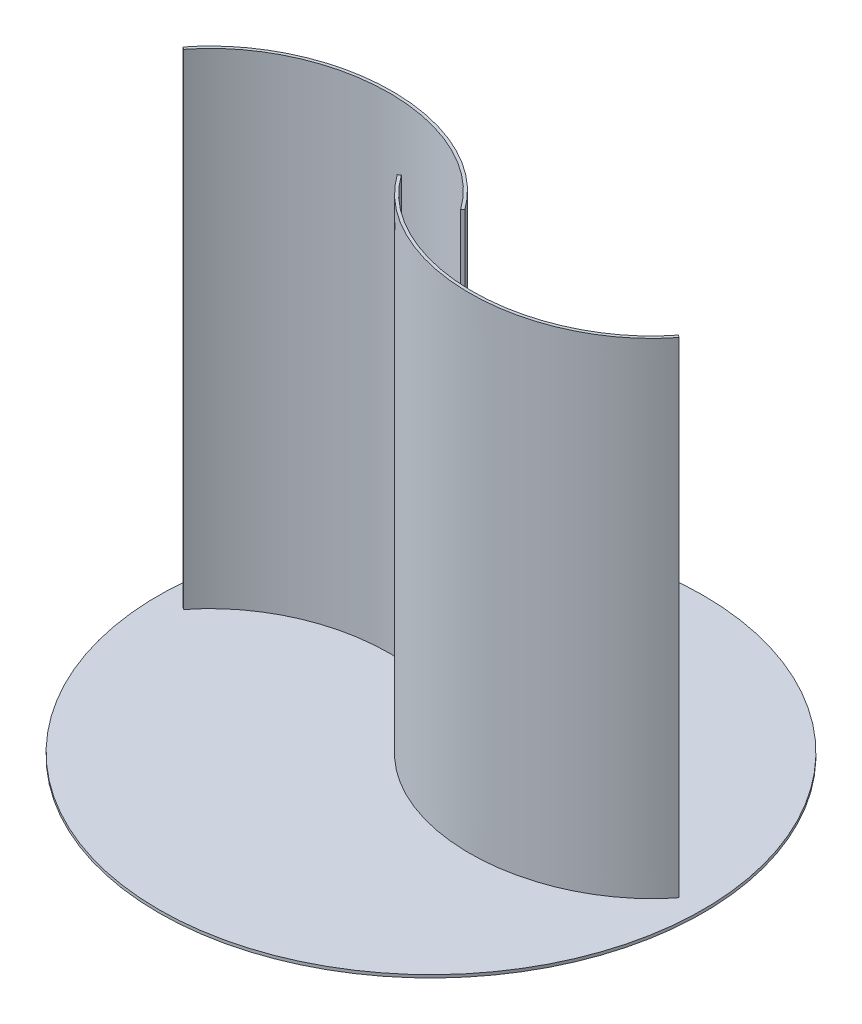
from build123d import *

# Parameters (mm, degrees)
EXTRUIR_L_MINA1_DEPTH      = 500
CROQUIS2_R                 = 280.5
SALIENTE_EXTRUIR8_DEPTH    = 3
S_LIDO_MOVER_COPIAR1_ANGLE = 90
S_LIDO_MOVER_COPIAR4_ANGLE = 30
S_LIDO_MOVER_COPIAR5_ANGLE = 60


# Read off the part's stored shape, not the designer's step: Extruir-Lámina1
with BuildPart() as part:
    # Extruir-Lámina1 outline → Extruir-Lámina1 (new body)
    with BuildSketch(Plane(origin=(0, 0, 0), x_dir=(1, 0, 0), z_dir=(0, 1, 0))):
        with BuildLine():
            Line((30.6, 0), (33.045192794, 1.738111676))
            add(Edge.make_bspline(
                [(33.045192794, 1.738111676), (29.325331418, 6.971249659), (25.217625759, 11.992104492), (16.292959006, 21.531152277), (11.476041906, 26.049316609), (1.210067227, 34.513346738), (-4.238946213, 38.459188481), (-15.682725139, 45.718247967), (-21.67744537, 49.03144478), (-34.118312716, 54.97487064), (-40.564412482, 57.605081709), (-53.807162636, 62.142757905), (-60.603763125, 64.050208568), (-74.441544914, 67.113640591), (-81.482673915, 68.269611786), (-95.699983428, 69.812788852), (-102.876109859, 70.199989547), (-117.251923935, 70.199989547), (-124.451556616, 69.812789113), (-138.762571325, 68.27008593), (-145.873898544, 67.114589032), (-159.897819572, 64.053035779), (-166.810359776, 62.146990717), (-180.329183361, 57.61346979), (-186.935415282, 54.986010224), (-199.738637725, 49.04975895), (-205.93557964, 45.740987864), (-217.823279809, 38.492625566), (-223.513992633, 34.553058481), (-234.299746056, 26.103355079), (-239.394744204, 21.593245666), (-248.908350293, 12.071679353), (-253.326918033, 7.060251904), (-257.371935205, 1.836824266)],
                knots=[0, 0, 0, 0, 0.0625, 0.0625, 0.125, 0.125, 0.1875, 0.1875, 0.25, 0.25, 0.3125, 0.3125, 0.375, 0.375, 0.4375, 0.4375, 0.5, 0.5, 0.5625, 0.5625, 0.625, 0.625, 0.6875, 0.6875, 0.75, 0.75, 0.8125, 0.8125, 0.875, 0.875, 0.9375, 0.9375, 1, 1, 1, 1], degree=3))
            Line((-257.371935205, 1.836824266), (-255, 0))
            add(Edge.make_bspline(
                [(30.6, 0), (-106.087850725, 192.293827945), (-255, 0)],
                knots=[3.606762326, 3.606762326, 3.606762326, 5.614135135, 5.614135135, 5.614135135], degree=2, weights=[1, 0.537196639, 1]))
        make_face()
        with BuildLine():
            Line((-30.6, 0), (-33.045192794, -1.738111676))
            add(Edge.make_bspline(
                [(-33.045192794, -1.738111676), (-29.325331418, -6.971249659), (-25.217625759, -11.992104492), (-16.292959006, -21.531152277), (-11.476041906, -26.049316609), (-1.210067227, -34.513346738), (4.238946213, -38.459188481), (15.682725139, -45.718247967), (21.67744537, -49.03144478), (34.118312716, -54.97487064), (40.564412482, -57.605081709), (53.807162636, -62.142757905), (60.603763125, -64.050208568), (74.441544914, -67.113640591), (81.482673915, -68.269611786), (95.699983428, -69.812788852), (102.876109859, -70.199989547), (117.251923935, -70.199989547), (124.451556616, -69.812789113), (138.762571325, -68.27008593), (145.873898544, -67.114589032), (159.897819572, -64.053035779), (166.810359776, -62.146990717), (180.329183361, -57.61346979), (186.935415282, -54.986010224), (199.738637725, -49.04975895), (205.93557964, -45.740987864), (217.823279809, -38.492625566), (223.513992633, -34.553058481), (234.299746056, -26.103355079), (239.394744204, -21.593245666), (248.908350293, -12.071679353), (253.326918033, -7.060251904), (257.371935205, -1.836824266)],
                knots=[0, 0, 0, 0, 0.0625, 0.0625, 0.125, 0.125, 0.1875, 0.1875, 0.25, 0.25, 0.3125, 0.3125, 0.375, 0.375, 0.4375, 0.4375, 0.5, 0.5, 0.5625, 0.5625, 0.625, 0.625, 0.6875, 0.6875, 0.75, 0.75, 0.8125, 0.8125, 0.875, 0.875, 0.9375, 0.9375, 1, 1, 1, 1], degree=3))
            Line((257.371935205, -1.836824266), (255, 0))
            add(Edge.make_bspline(
                [(-30.6, 0), (106.087850725, -192.293827945), (255, 0)],
                knots=[3.606762326, 3.606762326, 3.606762326, 5.614135135, 5.614135135, 5.614135135], degree=2, weights=[1, 0.537196639, 1]))
        make_face()
    extrude(amount=EXTRUIR_L_MINA1_DEPTH)

    # Croquis2 → Saliente-Extruir8 (add)
    with BuildSketch(Plane.XZ):
        with Locations(Location((0, 0, 0), (0, 0, 270))):
            Circle(CROQUIS2_R)
    extrude(amount=SALIENTE_EXTRUIR8_DEPTH)


with BuildPart() as part_1:
    # Sólido-Mover/Copiar1: moved
    add(part.part.rotate(Axis((0, 0, 0), (0, -1, 0)), S_LIDO_MOVER_COPIAR1_ANGLE))


with BuildPart() as part_2:
    # Sólido-Mover/Copiar4: moved
    add(part_1.part.rotate(Axis((0, 0, 0), (0, 1, 0)), S_LIDO_MOVER_COPIAR4_ANGLE))


with BuildPart() as part_3:
    # Sólido-Mover/Copiar5: moved
    add(part_2.part.rotate(Axis((0, 0, 0), (0, 1, 0)), S_LIDO_MOVER_COPIAR5_ANGLE))


solid = part_3.part
